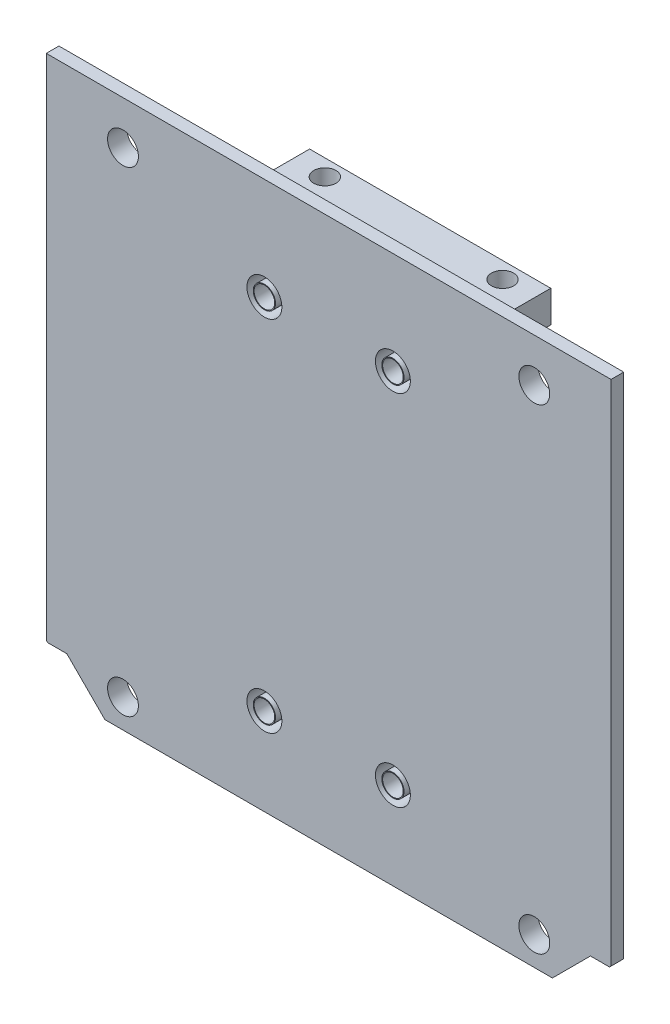
from build123d import *

# Parameters (mm, degrees)
SKETCH3_W             = 38
SKETCH3_H             = 6
BOSS_EXTRUDE2_DEPTH   = 8
BOSS_EXTRUDE2_2_DEPTH = 8
SKETCH1_R             = 2.43
BOSS_EXTRUDE3_DEPTH   = 3
CHAMFER1_SIZE         = 1
SKETCH4_W             = 38
SKETCH4_H             = 5
BOSS_EXTRUDE4_DEPTH   = 16
SKETCH5_R             = 1.75
CUT_EXTRUDE1_DEPTH    = 80
SKETCH6_R             = 1.625
CUT_EXTRUDE2_DEPTH    = 10
SKETCH7_R             = 2.75
SKETCH7_R_2           = 1.75
CUT_EXTRUDE3_DEPTH    = 4


with BuildPart() as part:
    # Sketch3 → Boss-Extrude2 (new body)
    with BuildSketch(Plane.XY):
        with Locations((152.499981225, 110.845805079)):
            Rectangle(SKETCH3_W, SKETCH3_H)
    extrude(amount=-BOSS_EXTRUDE2_DEPTH)



with BuildPart() as body_2:
    # Sketch3 → Boss-Extrude2 2 (new body)
    with BuildSketch(Plane.XY):
        with Locations((152.499981225, 166.845805079)):
            Rectangle(SKETCH3_W, SKETCH3_H)
    extrude(amount=-BOSS_EXTRUDE2_2_DEPTH)


with BuildPart() as body_3:
    # Sketch1 → Boss-Extrude3 (new body)
    with BuildSketch(Plane.XY):
        Polygon((197.000000954, 103.088447924), (197.000000954, 183.154169798), (107.999998748, 183.154169798), (107.999998748, 103.08845101), (108.242627497, 102.845828652), (111.242642284, 102.845828652), (117.242639543, 96.845823944), (187.757360159, 96.845823944), (193.757357418, 102.845828652), (196.757376569, 102.845828652), align=None)
        with Locations((184.906666899, 176.322621726)):
            Circle(SKETCH1_R, mode=Mode.SUBTRACT)
        with Locations((120.09, 176.322621726)):
            Circle(SKETCH1_R, mode=Mode.SUBTRACT)
        with Locations((184.906666899, 101.371103796)):
            Circle(SKETCH1_R, mode=Mode.SUBTRACT)
        with Locations((120.09, 101.371103796)):
            Circle(SKETCH1_R, mode=Mode.SUBTRACT)
    extrude(amount=-BOSS_EXTRUDE3_DEPTH)

    # Chamfer1
    # the kernel refuses this chamfer: 1 mm, written as the material it takes off along each edge
    with BuildSketch(Plane(origin=(105.670944509, 102.845828652, -3), x_dir=(0, -0.027495876610582174, 0.9996219169112968), z_dir=(1, 0, 0))) as chamfer1_piece_1_section:
        Polygon((CHAMFER1_SIZE * 0.999621916911, -CHAMFER1_SIZE * 0.0274958766106), (-CHAMFER1_SIZE * 0.0274958766106, -CHAMFER1_SIZE * 0.999621916911), (0, 0), align=None)
    chamfer1_piece_1 = extrude(amount=8.143380763, mode=Mode.PRIVATE)
    chamfer1_piece_1 = split(chamfer1_piece_1, bisect_by=Plane(origin=(109.611460338, 104.477012624, -2.663729969), z_dir=(-0.7071072202160112, -0.7071063421568112, 0)), keep=Keep.TOP, mode=Mode.PRIVATE)
    add(chamfer1_piece_1, mode=Mode.SUBTRACT)
    with BuildSketch(Plane(origin=(109.424188934, 104.664284261, -3), x_dir=(-0.019442532877514053, -0.01944250873450663, 0.9996219169112968), z_dir=(0.7071063421568113, -0.7071072202160114, 0))) as chamfer1_piece_2_section:
        Polygon((CHAMFER1_SIZE * 0.999621916911, -CHAMFER1_SIZE * 0.0274958766106), (-CHAMFER1_SIZE * 0.0274958766106, -CHAMFER1_SIZE * 0.999621916911), (0, 0), align=None)
    chamfer1_piece_2 = extrude(amount=13.628648741, mode=Mode.PRIVATE)
    chamfer1_piece_2 = split(chamfer1_piece_2, bisect_by=Plane(origin=(115.495387611, 102.845828652, -2.667041635), z_dir=(0, -1, 0)), keep=Keep.TOP, mode=Mode.PRIVATE)
    add(chamfer1_piece_2, mode=Mode.SUBTRACT)
    with BuildSketch(Plane(origin=(191.18567443, 102.845828652, -3), x_dir=(0, -0.027495876610582174, 0.9996219169112968), z_dir=(1, 0, 0))) as chamfer1_piece_3_section:
        Polygon((CHAMFER1_SIZE * 0.999621916911, -CHAMFER1_SIZE * 0.0274958766106), (-CHAMFER1_SIZE * 0.0274958766106, -CHAMFER1_SIZE * 0.999621916911), (0, 0), align=None)
    chamfer1_piece_3 = extrude(amount=8.143385128, mode=Mode.PRIVATE)
    chamfer1_piece_3 = split(chamfer1_piece_3, bisect_by=Plane(origin=(195.388540462, 104.477013723, -2.663729975), z_dir=(0.7071072202160112, -0.7071063421568112, 0)), keep=Keep.TOP, mode=Mode.PRIVATE)
    add(chamfer1_piece_3, mode=Mode.SUBTRACT)
    with BuildSketch(Plane(origin=(185.938906809, 95.027368335, -3), x_dir=(0.019442532877507145, -0.019442508734499722, 0.999621916911297), z_dir=(0.7071063421568113, 0.7071072202160114, 0))) as chamfer1_piece_4_section:
        Polygon((CHAMFER1_SIZE * 0.999621916911, -CHAMFER1_SIZE * 0.0274958766106), (-CHAMFER1_SIZE * 0.0274958766106, -CHAMFER1_SIZE * 0.999621916911), (0, 0), align=None)
    chamfer1_piece_4 = extrude(amount=13.628648741, mode=Mode.PRIVATE)
    chamfer1_piece_4 = split(chamfer1_piece_4, bisect_by=Plane(origin=(189.504612091, 102.845828652, -2.667041635), z_dir=(0, -1, 0)), keep=Keep.TOP, mode=Mode.PRIVATE)
    add(chamfer1_piece_4, mode=Mode.SUBTRACT)
    with BuildSketch(Plane(origin=(114.670956555, 96.845823944, -3), x_dir=(0, -0.027495876610582174, 0.9996219169112968), z_dir=(1, 0, 0))) as chamfer1_piece_5:
        Polygon((CHAMFER1_SIZE * 0.999621916911, -CHAMFER1_SIZE * 0.0274958766106), (-CHAMFER1_SIZE * 0.0274958766106, -CHAMFER1_SIZE * 0.999621916911), (0, 0), align=None)
    extrude(amount=75.658086593, mode=Mode.SUBTRACT)
    with BuildSketch(Plane(origin=(107.999998748, 185.725852786, -3), x_dir=(-0.027495876610582174, 0, 0.9996219169112968), z_dir=(0, -1, 0))) as chamfer1_piece_6:
        Polygon((CHAMFER1_SIZE * 0.999621916911, -CHAMFER1_SIZE * 0.0274958766106), (-CHAMFER1_SIZE * 0.0274958766106, -CHAMFER1_SIZE * 0.999621916911), (0, 0), align=None)
    extrude(amount=85.209084764, mode=Mode.SUBTRACT)
    with BuildSketch(Plane(origin=(199.571683942, 183.154169798, -3), x_dir=(0, 0.027495876610582174, 0.9996219169112968), z_dir=(-1, 0, 0))) as chamfer1_piece_7:
        Polygon((CHAMFER1_SIZE * 0.999621916911, -CHAMFER1_SIZE * 0.0274958766106), (-CHAMFER1_SIZE * 0.0274958766106, -CHAMFER1_SIZE * 0.999621916911), (0, 0), align=None)
    extrude(amount=94.143368181, mode=Mode.SUBTRACT)
    with BuildSketch(Plane(origin=(197.000000954, 100.516764936, -3), x_dir=(0.027495876610582174, 0, 0.9996219169112968), z_dir=(0, 1, 0))) as chamfer1_piece_8:
        Polygon((CHAMFER1_SIZE * 0.999621916911, -CHAMFER1_SIZE * 0.0274958766106), (-CHAMFER1_SIZE * 0.0274958766106, -CHAMFER1_SIZE * 0.999621916911), (0, 0), align=None)
    extrude(amount=85.20908785, mode=Mode.SUBTRACT)
    with BuildSketch(Plane(origin=(105.670944509, 102.845828652, -3), x_dir=(0, -0.027495876610582174, 0.9996219169112968), z_dir=(1, 0, 0))) as chamfer1_piece_9a_section:
        Polygon((CHAMFER1_SIZE * 0.999621916911, -CHAMFER1_SIZE * 0.0274958766106), (-CHAMFER1_SIZE * 0.0274958766106, -CHAMFER1_SIZE * 0.999621916911), (0, 0), align=None)
    chamfer1_piece_9a = extrude(amount=8.143380763, mode=Mode.PRIVATE)
    chamfer1_piece_9a = split(chamfer1_piece_9a, bisect_by=Plane(origin=(111.621802536, 102.46666793, -2.681906862), z_dir=(0.7071072202160112, 0.7071063421568112, 0)), keep=Keep.TOP, mode=Mode.PRIVATE)
    with BuildSketch(Plane(origin=(109.424188934, 104.664284261, -3), x_dir=(-0.019442532877514053, -0.01944250873450663, 0.9996219169112968), z_dir=(0.7071063421568113, -0.7071072202160114, 0))) as chamfer1_piece_9b_section:
        Polygon((CHAMFER1_SIZE * 0.999621916911, -CHAMFER1_SIZE * 0.0274958766106), (-CHAMFER1_SIZE * 0.0274958766106, -CHAMFER1_SIZE * 0.999621916911), (0, 0), align=None)
    chamfer1_piece_9b = extrude(amount=13.628648741, mode=Mode.PRIVATE)
    chamfer1_piece_9b = split(chamfer1_piece_9b, bisect_by=Plane(origin=(110.706428382, 102.845828652, -2.681906862), z_dir=(0, 1, 0)), keep=Keep.TOP, mode=Mode.PRIVATE)
    chamfer1_piece_9 = chamfer1_piece_9a & chamfer1_piece_9b
    add(chamfer1_piece_9, mode=Mode.SUBTRACT)
    with BuildSketch(Plane(origin=(185.938906809, 95.027368335, -3), x_dir=(0.019442532877507145, -0.019442508734499722, 0.999621916911297), z_dir=(0.7071063421568113, 0.7071072202160114, 0))) as chamfer1_piece_10a_section:
        Polygon((CHAMFER1_SIZE * 0.999621916911, -CHAMFER1_SIZE * 0.0274958766106), (-CHAMFER1_SIZE * 0.0274958766106, -CHAMFER1_SIZE * 0.999621916911), (0, 0), align=None)
    chamfer1_piece_10a = extrude(amount=13.628648741, mode=Mode.PRIVATE)
    chamfer1_piece_10a = split(chamfer1_piece_10a, bisect_by=Plane(origin=(194.29357132, 102.845828652, -2.681906862), z_dir=(0, 1, 0)), keep=Keep.TOP, mode=Mode.PRIVATE)
    with BuildSketch(Plane(origin=(191.18567443, 102.845828652, -3), x_dir=(0, -0.027495876610582174, 0.9996219169112968), z_dir=(1, 0, 0))) as chamfer1_piece_10b_section:
        Polygon((CHAMFER1_SIZE * 0.999621916911, -CHAMFER1_SIZE * 0.0274958766106), (-CHAMFER1_SIZE * 0.0274958766106, -CHAMFER1_SIZE * 0.999621916911), (0, 0), align=None)
    chamfer1_piece_10b = extrude(amount=8.143385128, mode=Mode.PRIVATE)
    chamfer1_piece_10b = split(chamfer1_piece_10b, bisect_by=Plane(origin=(193.378197166, 102.46666793, -2.681906862), z_dir=(-0.7071072202160112, 0.7071063421568112, 0)), keep=Keep.TOP, mode=Mode.PRIVATE)
    chamfer1_piece_10 = chamfer1_piece_10a & chamfer1_piece_10b
    add(chamfer1_piece_10, mode=Mode.SUBTRACT)


with BuildPart() as part_1:
    add(part.part)

    add(body_2.part)  # Boss-Extrude4 merges body 2

    add(body_3.part)  # Boss-Extrude4 merges body 3
    # Sketch4 → Boss-Extrude4 (add)
    with BuildSketch(Plane.XY):
        with Locations((152.499981225, 172.345805079)):
            Rectangle(SKETCH4_W, SKETCH4_H)
        with Locations((152.499981225, 105.345805079)):
            Rectangle(SKETCH4_W, SKETCH4_H)
    extrude(amount=-BOSS_EXTRUDE4_DEPTH)

    # Sketch5 → Cut-Extrude1 (cut)
    with BuildSketch(Plane(origin=(0, 102.845805079, 0), x_dir=(-1, 0, 0), z_dir=(0, -1, 0))):
        with Locations(Location((-166.499981225, 13.4, 0), (0, 0, 180))):
            Circle(SKETCH5_R)
        with Locations(Location((-138.499981225, 13.4, 0), (0, 0, 180))):
            Circle(SKETCH5_R)
    extrude(amount=-CUT_EXTRUDE1_DEPTH, mode=Mode.SUBTRACT)

    # Sketch6 → Cut-Extrude2 (cut)
    with BuildSketch(Plane(origin=(0, 0, -8), x_dir=(-1, 0, 0), z_dir=(0, 0, -1))):
        with Locations((-162.624981225, 110.595805079)):
            Circle(SKETCH6_R)
        with Locations((-142.374981225, 110.595805079)):
            Circle(SKETCH6_R)
        with Locations((-162.624981225, 167.095805079)):
            Circle(SKETCH6_R)
        with Locations((-142.374981225, 167.095805079)):
            Circle(SKETCH6_R)
    extrude(amount=-CUT_EXTRUDE2_DEPTH, mode=Mode.SUBTRACT)

    # Sketch7 → Cut-Extrude3 (cut)
    # profile 1 of 4: a face of its own
    with BuildSketch(Plane.XY):
        with Locations((162.624981225, 167.095805079)):
            Circle(SKETCH7_R)
        with Locations((162.624981225, 167.095805079)):
            Circle(SKETCH7_R_2, mode=Mode.SUBTRACT)
    # profile 2 of 4: a face of its own
    with BuildSketch(Plane.XY):
        with Locations((142.374981225, 167.095805079)):
            Circle(SKETCH7_R)
        with Locations((142.374981225, 167.095805079)):
            Circle(SKETCH7_R_2, mode=Mode.SUBTRACT)
    # profile 3 of 4: a face of its own
    with BuildSketch(Plane.XY):
        with Locations((162.624981225, 110.595805079)):
            Circle(SKETCH7_R)
        with Locations((162.624981225, 110.595805079)):
            Circle(SKETCH7_R_2, mode=Mode.SUBTRACT)
    # profile 4 of 4: a face of its own
    with BuildSketch(Plane.XY):
        with Locations((142.374981225, 110.595805079)):
            Circle(SKETCH7_R)
        with Locations((142.374981225, 110.595805079)):
            Circle(SKETCH7_R_2, mode=Mode.SUBTRACT)
    extrude(amount=-CUT_EXTRUDE3_DEPTH, mode=Mode.SUBTRACT)


solid = part_1.part
